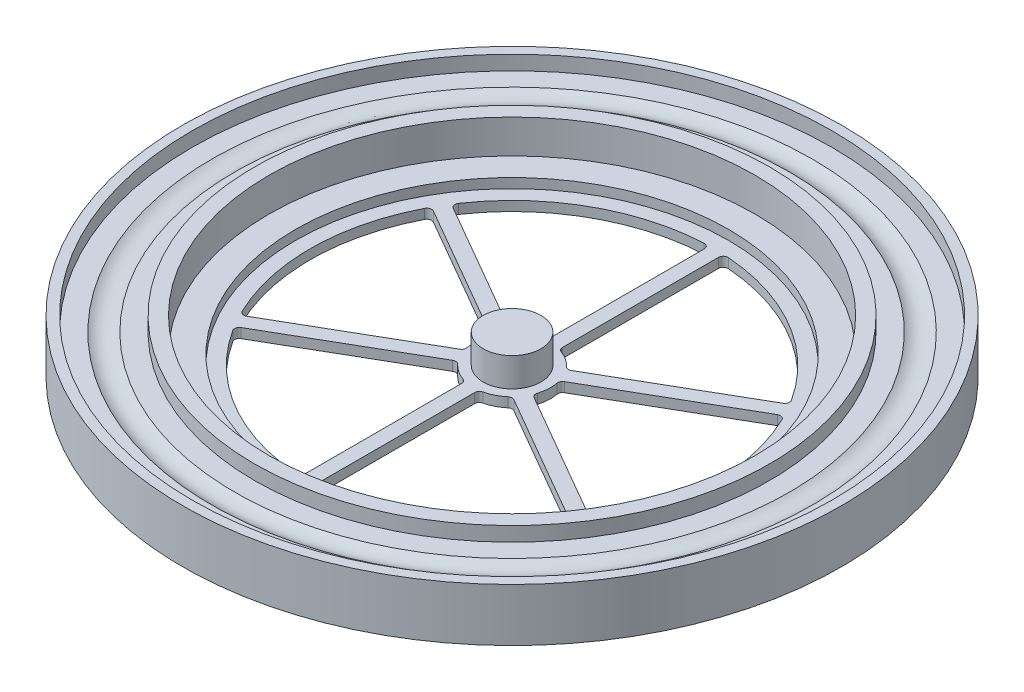
from build123d import *

# Parameters (mm, degrees)
CUT_EXTRUDE1_DEPTH = 98.49615377
CIRPATTERN1_COUNT  = 6


with BuildPart() as part:
    # Sketch1 → Revolve1 (revolve)
    with BuildSketch(Plane.XY):
        with BuildLine():
            Line((0, 0), (0, 8))
            Line((0, 8), (6, 8))
            Line((6, 8), (6, 2))
            Line((6, 2), (45, 2))
            Line((45, 2), (45, 4))
            Line((45, 4), (50.5, 4))
            Line((50.5, 4), (50.5, 11))
            Line((50.5, 11), (53.5, 11))
            Line((53.5, 11), (53.5, 8))
            Line((53.5, 8), (57.648404797, 8))
            ThreePointArc((57.648404797, 8), (60, 7.3), (62.351595203, 8))
            Line((62.351595203, 8), (66.5, 8))
            Line((66.5, 8), (66.5, 11))
            Line((66.5, 11), (68.5, 11))
            Line((68.5, 11), (68.5, 0))
            Line((68.5, 0), (0, 0))
        make_face()
    revolve(axis=Axis((0, 0, 0), (0, 1, 0)))

    # Sketch2 → Cut-Extrude1 (cut, through all)
    with BuildSketch(Plane(origin=(0, 0, 0), x_dir=(1, 0, 0), z_dir=(0, 1, 0))):
        with BuildLine():
            Line((-34.411862419, 22.177099108), (-6.348469228, 5.974691495))
            ThreePointArc((-6.348469228, 5.974691495), (-5.756717519, 5.844934983), (-5.198639314, 6.080637243))
            ThreePointArc((-5.198639314, 6.080637243), (-3.592578979, 7.147963086), (-1.777777778, 7.799968344))
            ThreePointArc((-1.777777778, 7.799968344), (-1.21826404, 8.151354823), (-1, 8.774964387))
            Line((-1, 8.774964387), (-1, 40.951190459))
            ThreePointArc((-1, 40.951190459), (-1.310355341, 41.675338402), (-2.048780488, 41.949999982))
            ThreePointArc((-2.048780488, 41.949999982), (-20.554031515, 36.626927096), (-34.738981015, 23.605151939))
            ThreePointArc((-34.738981015, 23.605151939), (-34.886616062, 22.819841426), (-34.411862419, 22.177099108))
        make_face()
    cut_extrude1 = extrude(amount=CUT_EXTRUDE1_DEPTH, mode=Mode.SUBTRACT)

    # CirPattern1: Cut-Extrude1 ×6 about axis
    cirpattern1_axis = Axis((0, 8, 0), (0, -1, 0))
    for i in range(1, CIRPATTERN1_COUNT):
        add(cut_extrude1.rotate(cirpattern1_axis, i * 360 / CIRPATTERN1_COUNT), mode=Mode.SUBTRACT)


solid = part.part
